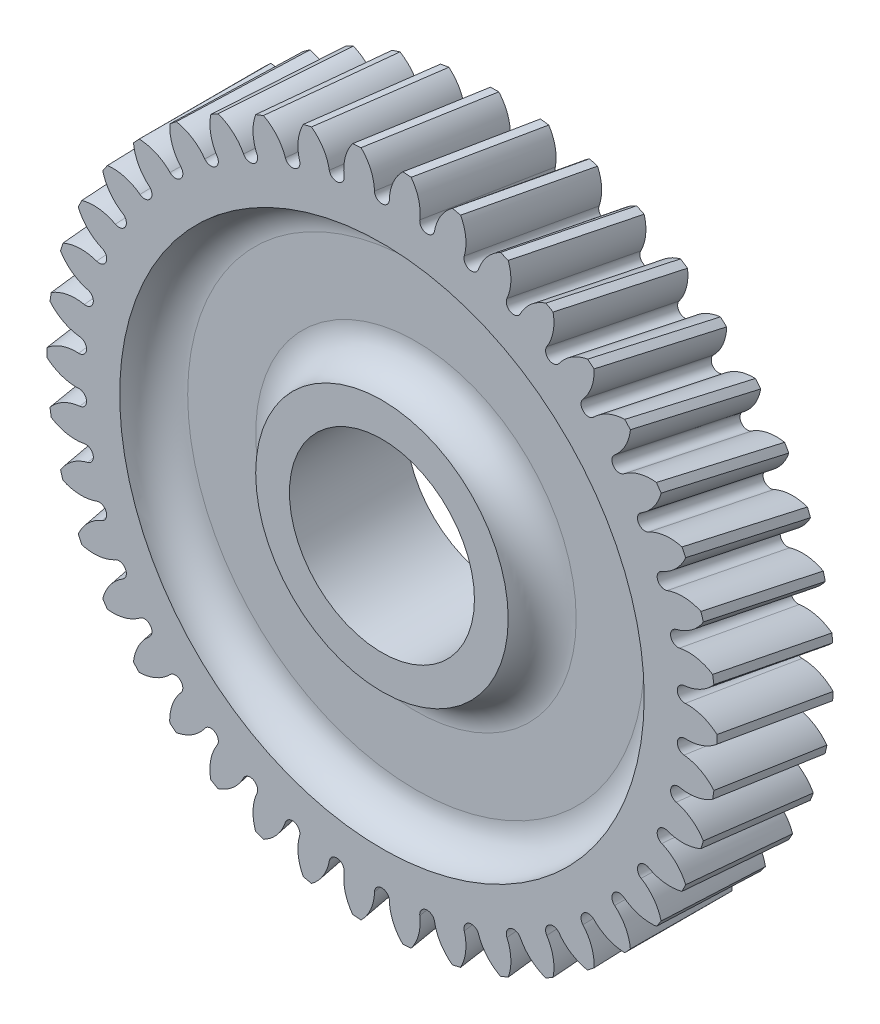
from build123d import *

# Parameters (mm, degrees)
CUT_SWEEP1_PITCH       = 1193.22836765
CUT_SWEEP1_HEIGHT      = 30
CUT_SWEEP1_RADIUS      = 34.5
CUT_SWEEP1_START_ANGLE = 90
CIRPATTERN1_COUNT      = 42


with BuildPart() as part:
    # Sketch1 → Revolve1 (revolve)
    with BuildSketch(Plane(origin=(0, 0, 0), x_dir=(0, 0, -1), z_dir=(1, 0, 0)), mode=Mode.PRIVATE) as revolve1_sk:
        with BuildLine():
            Line((6, 9.525), (-6, 9.525))
            Line((-6, 9.525), (-6, 13))
            ThreePointArc((-6, 13), (-3.525126266, 14.025126266), (-2.5, 16.5))
            Line((-2.5, 16.5), (-2.5, 23.5))
            ThreePointArc((-2.5, 23.5), (-3.525126266, 25.974873734), (-6, 27))
            Line((-6, 27), (-6, 34.5))
            Line((-6, 34.5), (6, 34.5))
            Line((6, 34.5), (6, 27))
            ThreePointArc((6, 27), (3.525126266, 25.974873734), (2.5, 23.5))
            Line((2.5, 23.5), (2.5, 16.5))
            ThreePointArc((2.5, 16.5), (3.525126266, 14.025126266), (6, 13))
            Line((6, 13), (6, 9.525))
        make_face()
    revolve(revolve1_sk.sketch.rotate(Axis((0, 0, 0), (0, 0, -1)), 90), axis=Axis((0, 0, 0), (0, 0, -1)))

    # Cut-Sweep1: sweep along a helix
    with BuildLine() as cut_sweep1_path:
        add(Helix(CUT_SWEEP1_PITCH, CUT_SWEEP1_HEIGHT, CUT_SWEEP1_RADIUS, center=(0, 0, 6), direction=(0, 0, -1), mode=Mode.PRIVATE).rotate(Axis((0, 0, 6), (0, 0, -1)), CUT_SWEEP1_START_ANGLE))
    # Sketch2 → Cut-Sweep1 (sweep, cut)
    with BuildSketch(Plane.XY.offset(6)):
        with BuildLine():
            ThreePointArc((2.15, 34.432942076), (0, 34.5), (-2.15, 34.432942076))
            ThreePointArc((-2.15, 34.432942076), (-1.149256105, 32.97603937), (-0.768675058, 31.25))
            ThreePointArc((-0.768675058, 31.25), (0, 30.5), (0.768675058, 31.25))
            ThreePointArc((0.768675058, 31.25), (1.149256105, 32.97603937), (2.15, 34.432942076))
        make_face()
    cut_sweep1 = sweep(path=cut_sweep1_path.line, is_frenet=True, mode=Mode.SUBTRACT)

    # CirPattern1: Cut-Sweep1 ×42 about axis
    cirpattern1_axis = Axis((0, 0, 0), (0, 0, 1))
    for i in range(1, CIRPATTERN1_COUNT):
        add(cut_sweep1.rotate(cirpattern1_axis, i * 360 / CIRPATTERN1_COUNT), mode=Mode.SUBTRACT)


solid = part.part
